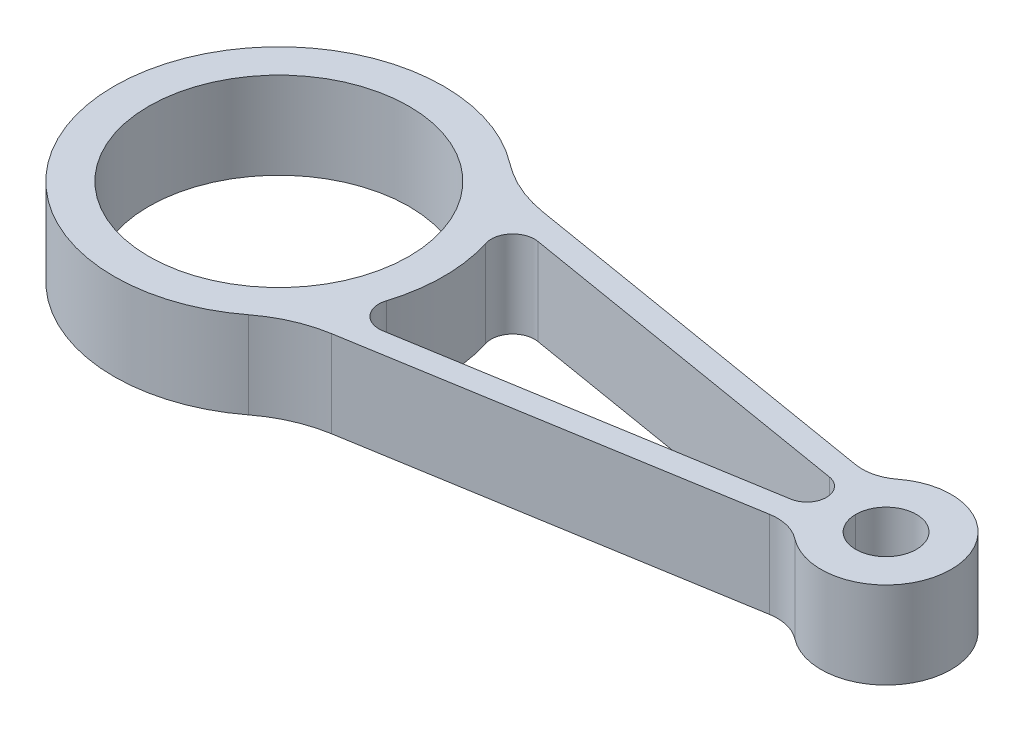
from build123d import *

# Parameters (mm, degrees)
SKETCH1_R           = 7
SKETCH1_R_2         = 30
BOSS_EXTRUDE1_DEPTH = 10
FILLET1_R           = 30
FILLET2_R           = 10
CUT_EXTRUDE1_DEPTH  = 161.838428244


with BuildPart() as part:
    # Sketch1 → Boss-Extrude1 (new, symmetric)
    with BuildSketch(Plane(origin=(0, 0, 0), x_dir=(1, 0, 0), z_dir=(0, 1, 0))):
        with BuildLine():
            ThreePointArc((27.935473676, 25.760615491), (-38, 0), (27.935473676, -25.760615491))
            Line((27.935473676, -25.760615491), (128.063755469, -9.084385863))
            ThreePointArc((128.063755469, -9.084385863), (155, 0), (128.063755469, 9.084385863))
            Line((128.063755469, 9.084385863), (27.935473676, 25.760615491))
        make_face()
        with Locations((140, 0)):
            Circle(SKETCH1_R, mode=Mode.SUBTRACT)
        Circle(SKETCH1_R_2, mode=Mode.SUBTRACT)
    extrude(amount=BOSS_EXTRUDE1_DEPTH, both=True)

    # Fillet1
    fillet1_edges = [part.edges().sort_by_distance(p)[0] for p in [
        (27.935473676, 0, 25.760615491),
        (27.935473676, 0, -25.760615491),
    ]]
    fillet(fillet1_edges, radius=FILLET1_R)

    # Fillet2
    fillet2_edges = [part.edges().sort_by_distance(p)[0] for p in [
        (128.063755469, 0, 9.084385863),
        (128.063755469, 0, -9.084385863),
    ]]
    fillet(fillet2_edges, radius=FILLET2_R)

    # Sketch2 → Cut-Extrude1 (cut, through all)
    with BuildSketch(Plane(origin=(0, 10, 0), x_dir=(1, 0, 0), z_dir=(0, 1, 0))):
        with BuildLine():
            Line((41.828554558, 17.870982725), (122.478416149, 4.438857582))
            ThreePointArc((122.478416149, 4.438857582), (126.239130435, 0), (122.478416149, -4.438857582))
            Line((122.478416149, -4.438857582), (41.828554558, -17.870982725))
            ThreePointArc((41.828554558, -17.870982725), (37.231968897, -16.217361812), (36.238855523, -11.43439331))
            ThreePointArc((36.238855523, -11.43439331), (38, 0), (36.238855523, 11.43439331))
            ThreePointArc((36.238855523, 11.43439331), (37.231968897, 16.217361812), (41.828554558, 17.870982725))
        make_face()
    extrude(amount=-CUT_EXTRUDE1_DEPTH, mode=Mode.SUBTRACT)


solid = part.part
